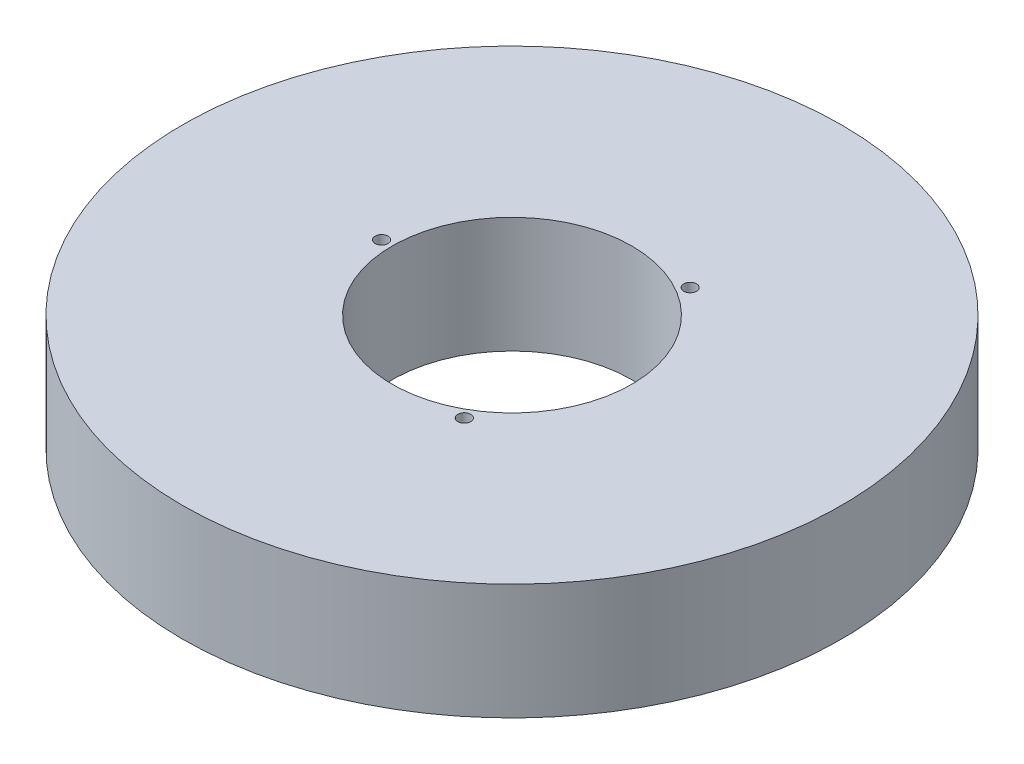
from build123d import *

# Parameters (mm, degrees)
SKETCH1_R           = 82.5
BOSS_EXTRUDE1_DEPTH = 29
SKETCH2_R           = 30
CUT_EXTRUDE1_DEPTH  = 121.222710001
SKETCH3_R           = 1.61367321
CUT_EXTRUDE2_DEPTH  = 18.825914011
CIRPATTERN1_COUNT   = 3


with BuildPart() as part:
    # Sketch1 → Boss-Extrude1 (new body)
    with BuildSketch(Plane(origin=(0, 0, 0), x_dir=(1, 0, 0), z_dir=(0, 1, 0))):
        Circle(SKETCH1_R)
    extrude(amount=BOSS_EXTRUDE1_DEPTH)

    # Sketch2 → Cut-Extrude1 (cut, through all)
    with BuildSketch(Plane(origin=(0, 0, 0), x_dir=(1, 0, 0), z_dir=(0, 1, 0))):
        Circle(SKETCH2_R)
    extrude(amount=CUT_EXTRUDE1_DEPTH, mode=Mode.SUBTRACT)

    # Sketch3 → Cut-Extrude2 (cut)
    with BuildSketch(Plane(origin=(0, 29, 0), x_dir=(1, 0, 0), z_dir=(0, 1, 0))):
        with Locations((-32.646315538, 0)):
            Circle(SKETCH3_R)
    cut_extrude2 = extrude(amount=-CUT_EXTRUDE2_DEPTH, mode=Mode.SUBTRACT)

    # CirPattern1: Cut-Extrude2 ×3 about axis
    cirpattern1_axis = Axis((0, 0, 0), (0, 1, 0))
    for i in range(1, CIRPATTERN1_COUNT):
        add(cut_extrude2.rotate(cirpattern1_axis, i * 360 / CIRPATTERN1_COUNT), mode=Mode.SUBTRACT)


solid = part.part
